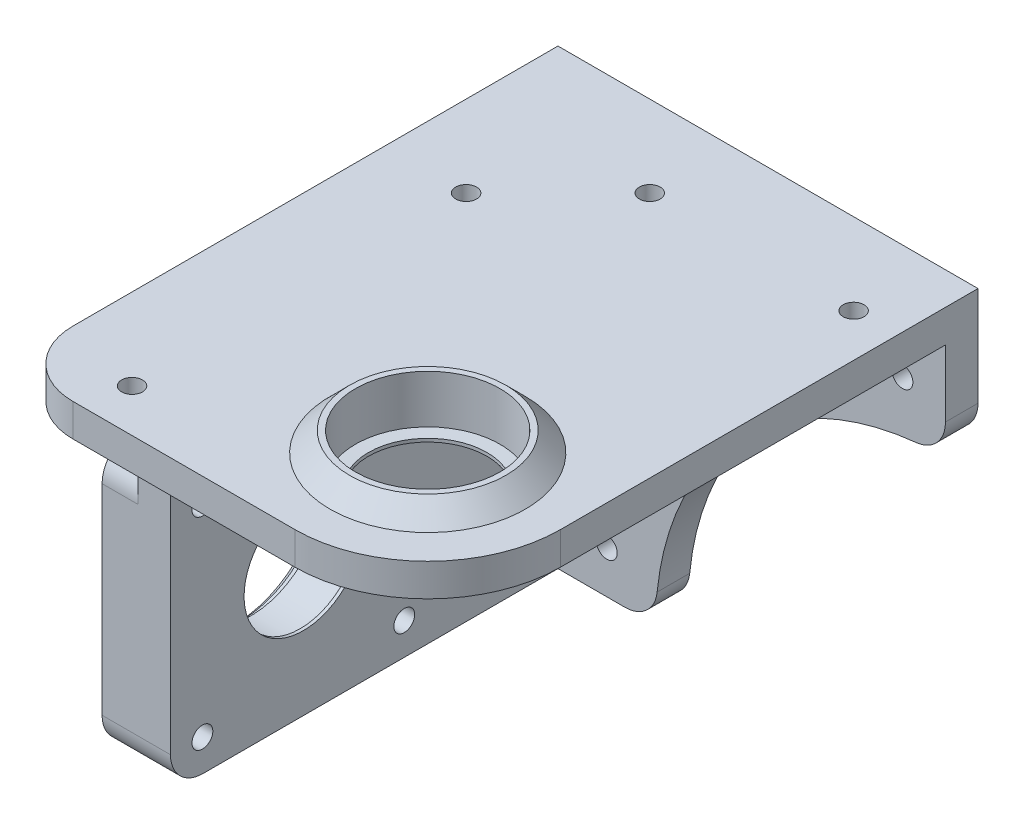
from build123d import *

# Parameters (mm, degrees)
SKETCH1_R           = 1.6
BOSS_EXTRUDE1_DEPTH = 5
BOSS_EXTRUDE2_DEPTH = 79.5
SKETCH3_R           = 11.1
CUT_EXTRUDE1_DEPTH  = 112.08808442
BOSS_EXTRUDE3_START = 3
SKETCH4_R           = 15
SKETCH4_R_2         = 11.1
BOSS_EXTRUDE3_DEPTH = 3
CHAMFER1_SIZE       = 3
BOSS_EXTRUDE4_START = -1
SKETCH5_R           = 11.1
SKETCH5_R_2         = 9.1
BOSS_EXTRUDE4_DEPTH = 1
CHAMFER2_SIZE       = 10
CHAMFER2_SIZE_2     = 0.5
SKETCH6_R           = 1.6
CUT_EXTRUDE2_DEPTH  = 112.08808442
SKETCH7_R           = 11.1
SKETCH7_R_2         = 1.6
CUT_EXTRUDE3_DEPTH  = 112.995814654
BOSS_EXTRUDE5_START = -1
SKETCH8_R           = 11.1
SKETCH8_R_2         = 9.1
BOSS_EXTRUDE5_DEPTH = 1
CHAMFER3_SIZE       = 10
CHAMFER3_SIZE_2     = 0.5
BOSS_EXTRUDE6_START = 5.5
SKETCH9_R           = 1.6
SKETCH9_R_2         = 11.1
BOSS_EXTRUDE6_DEPTH = 5.5
SKETCH10_R          = 12.5
CUT_EXTRUDE4_DEPTH  = 2.5
CHAMFER6_SIZE       = 1
CHAMFER5_SIZE       = 5.5
FILLET4_R           = 5
FILLET5_R           = 5
FILLET6_R           = 5
FILLET7_R           = 5
FILLET1_R           = 10


# Some blends are built 0.0001 mm under size
with BuildPart() as part:
    # Sketch1 → Boss-Extrude1 (new body)
    with BuildSketch(Plane.XY):
        with BuildLine():
            Line((-32.25, -32.25), (-16.996827309, -32.25))
            ThreePointArc((-16.996827309, -32.25), (-13.644608083, -30.959801378), (-12.022400308, -27.755050505))
            ThreePointArc((-12.022400308, -27.755050505), (0.783748237, -0.783748237), (27.755050505, 12.022400308))
            ThreePointArc((27.755050505, 12.022400308), (30.959801378, 13.644608083), (32.25, 16.996827309))
            Line((32.25, 16.996827309), (32.25, 32.25))
            Line((32.25, 32.25), (-32.25, 32.25))
            Line((-32.25, 32.25), (-32.25, -32.25))
        make_face()
        with Locations((-19.75, 19.75)):
            Circle(SKETCH1_R, mode=Mode.SUBTRACT)
        with Locations((-5.65, 19.75)):
            Circle(SKETCH1_R, mode=Mode.SUBTRACT)
        with Locations((25.65, 19.75)):
            Circle(SKETCH1_R, mode=Mode.SUBTRACT)
        with Locations((-19.75, 5.65)):
            Circle(SKETCH1_R, mode=Mode.SUBTRACT)
        with Locations((-19.75, -25.65)):
            Circle(SKETCH1_R, mode=Mode.SUBTRACT)
    extrude(amount=BOSS_EXTRUDE1_DEPTH)

    # Sketch2 → Boss-Extrude2 (add)
    with BuildSketch(Plane.XY.offset(5)):
        Polygon((-32.25, 32.25), (32.25, 32.25), (32.25, 27.25), (-27.25, 27.25), (-27.25, -32.25), (-32.25, -32.25), (-32.25, 27.25), align=None)
    extrude(amount=BOSS_EXTRUDE2_DEPTH)

    # Sketch3 → Cut-Extrude1 (cut, through all)
    with BuildSketch(Plane(origin=(0, 32.25, 0), x_dir=(1, 0, 0), z_dir=(0, 1, 0))):
        with Locations(Location((11.85, -64.1, 0), (0, 0, 270))):
            Circle(SKETCH3_R)
        with BuildLine():
            Line((11.85, -84.5), (11.85, -91.476631288))
            Line((11.85, -91.476631288), (44.100409765, -91.476631288))
            Line((44.100409765, -91.476631288), (44.100409765, -64.1))
            Line((44.100409765, -64.1), (32.25, -64.1))
            ThreePointArc((32.25, -64.1), (26.274978336, -78.524978336), (11.85, -84.5))
        make_face()
    extrude(amount=-CUT_EXTRUDE1_DEPTH, mode=Mode.SUBTRACT)

    # Sketch4 → Boss-Extrude3 (add)
    with BuildSketch(Plane(origin=(0, 32.25, 0), x_dir=(1, 0, 0), z_dir=(0, 1, 0)).offset(BOSS_EXTRUDE3_START)):
        with Locations(Location((11.85, -64.1, 0), (0, 0, 90))):
            Circle(SKETCH4_R)
        with Locations(Location((11.85, -64.1, 0), (0, 0, 270))):
            Circle(SKETCH4_R_2, mode=Mode.SUBTRACT)
    extrude(amount=-BOSS_EXTRUDE3_DEPTH)

    # Chamfer1
    chamfer1_edges = [part.edges().sort_by_distance(p)[0] for p in [
        (11.85, 35.25, 79.1),
    ]]
    chamfer(chamfer1_edges, length=CHAMFER1_SIZE - 0.0001)  # a hair under: the kernel refuses the full size

    # Sketch5 → Boss-Extrude4 (add)
    with BuildSketch(Plane.XZ.offset(-27.25).offset(BOSS_EXTRUDE4_START)):
        with Locations(Location((11.85, 64.1, 0), (0, 0, 90))):
            Circle(SKETCH5_R)
        with Locations(Location((11.85, 64.1, 0), (0, 0, 270))):
            Circle(SKETCH5_R_2, mode=Mode.SUBTRACT)
    extrude(amount=BOSS_EXTRUDE4_DEPTH)

    # Chamfer2
    # the kernel refuses this chamfer: 10, 0.5 mm, written as the material it takes off along each edge
    with BuildSketch(Plane(origin=(11.85, 28.25, 64.1), x_dir=(0, 0, -1), z_dir=(-1, 0, 0))) as chamfer2_piece_1_section:
        Polygon((9.1 + CHAMFER2_SIZE, 0), (9.1, CHAMFER2_SIZE_2), (9.1, 0), align=None)
    chamfer2_piece_1 = revolve(axis=Axis((11.85, 28.25, 64.1), (0, -1, 0)), mode=Mode.PRIVATE)
    chamfer2_piece_1 = chamfer2_piece_1 & Plane(origin=(11.85, 27.834786479, 64.1), x_dir=(0, 0, 1), z_dir=(0, 1, 0)) * Cylinder(11.1, 77, mode=Mode.PRIVATE)
    add(chamfer2_piece_1, mode=Mode.SUBTRACT)

    # Sketch6 → Cut-Extrude2 (cut, through all)
    with BuildSketch(Plane(origin=(0, 32.25, 0), x_dir=(1, 0, 0), z_dir=(0, 1, 0))):
        with Locations(Location((-19.75, -26.6, 0), (0, 0, 270))):
            Circle(SKETCH6_R)
        with Locations(Location((-19.75, -77.9, 0), (0, 0, 270))):
            Circle(SKETCH6_R)
        with Locations(Location((-5.65, -12.5, 0), (0, 0, 270))):
            Circle(SKETCH6_R)
        with Locations(Location((25.65, -12.5, 0), (0, 0, 270))):
            Circle(SKETCH6_R)
    extrude(amount=-CUT_EXTRUDE2_DEPTH, mode=Mode.SUBTRACT)

    # Sketch7 → Cut-Extrude3 (cut, through all)
    with BuildSketch(Plane.ZY.offset(32.25)):
        with Locations((44.1, -11.85)):
            Circle(SKETCH7_R)
        with Locations((28.6, -27.35)):
            Circle(SKETCH7_R_2)
        with Locations((57.9, 19.75)):
            Circle(SKETCH7_R_2)
        with Locations((26.6, 19.75)):
            Circle(SKETCH7_R_2)
        with Locations((12.5, 5.65)):
            Circle(SKETCH7_R_2)
        with Locations((12.5, -25.65)):
            Circle(SKETCH7_R_2)
        with Locations((28.6, 3.65)):
            Circle(SKETCH7_R_2)
        with Locations((59.6, 3.65)):
            Circle(SKETCH7_R_2)
        with Locations((59.6, -27.35)):
            Circle(SKETCH7_R_2)
        with BuildLine():
            Line((64.5, -32.25), (64.5, 19.75))
            ThreePointArc((64.5, 19.75), (66.696699141, 25.053300859), (72, 27.25))
            Line((72, 27.25), (84.5, 27.25))
            Line((84.5, 27.25), (84.5, -32.25))
            Line((84.5, -32.25), (64.5, -32.25))
        make_face()
    extrude(amount=-CUT_EXTRUDE3_DEPTH, mode=Mode.SUBTRACT)

    # Sketch8 → Boss-Extrude5 (add)
    with BuildSketch(Plane(origin=(-27.25, 0, 0), x_dir=(0, 0, -1), z_dir=(1, 0, 0)).offset(BOSS_EXTRUDE5_START)):
        with Locations(Location((-44.1, -11.85, 0), (0, 0, 180))):
            Circle(SKETCH8_R)
        with Locations(Location((-44.1, -11.85, 0), (0, 0, 90))):
            Circle(SKETCH8_R_2, mode=Mode.SUBTRACT)
    extrude(amount=BOSS_EXTRUDE5_DEPTH)

    # Chamfer3
    # the kernel refuses this chamfer: 10, 0.5 mm, written as the material it takes off along each edge
    with BuildSketch(Plane(origin=(-28.25, -11.85, 44.1), x_dir=(0, 1, 0), z_dir=(0, 0, -1))) as chamfer3_piece_1_section:
        Polygon((9.1 + CHAMFER3_SIZE, 0), (9.1, CHAMFER3_SIZE_2), (9.1, 0), align=None)
    chamfer3_piece_1 = revolve(axis=Axis((-28.25, -11.85, 44.1), (1, 0, 0)), mode=Mode.PRIVATE)
    chamfer3_piece_1 = chamfer3_piece_1 & Plane(origin=(-27.834786479, -11.85, 44.1), x_dir=(0, 0, 1), z_dir=(-1, 0, 0)) * Cylinder(11.1, 77, mode=Mode.PRIVATE)
    add(chamfer3_piece_1, mode=Mode.SUBTRACT)

    # Sketch9 → Boss-Extrude6 (add)
    with BuildSketch(Plane.ZY.offset(32.25).offset(BOSS_EXTRUDE6_START)):
        Polygon((64.5, -32.25), (23.7, -32.25), (18.2, -32.25), (18.2, 8.55), (23.7, 8.55), (64.5, 8.55), align=None)
        with Locations((28.6, -27.35)):
            Circle(SKETCH9_R, mode=Mode.SUBTRACT)
        with Locations((28.6, 3.65)):
            Circle(SKETCH9_R, mode=Mode.SUBTRACT)
        with Locations((44.1, -11.85)):
            Circle(SKETCH9_R_2, mode=Mode.SUBTRACT)
        with Locations((59.6, 3.65)):
            Circle(SKETCH9_R, mode=Mode.SUBTRACT)
        with Locations((59.6, -27.35)):
            Circle(SKETCH9_R, mode=Mode.SUBTRACT)
    extrude(amount=-BOSS_EXTRUDE6_DEPTH)

    # Sketch10 → Cut-Extrude4 (cut)
    with BuildSketch(Plane.ZY.offset(37.75)):
        with Locations((44.1, -11.85)):
            Circle(SKETCH10_R)
    extrude(amount=-CUT_EXTRUDE4_DEPTH, mode=Mode.SUBTRACT)

    # Chamfer6
    chamfer6_edges = [part.edges().sort_by_distance(p)[0] for p in [
        (-37.75, -11.85, 31.6),
    ]]
    chamfer(chamfer6_edges, length=CHAMFER6_SIZE)

    # Chamfer5
    chamfer5_edges = [part.edges().sort_by_distance(p)[0] for p in [
        (-37.75, -11.85, 18.2),
    ]]
    chamfer(chamfer5_edges, length=CHAMFER5_SIZE - 0.0001)  # a hair under: the kernel refuses the full size

    # Fillet4
    fillet4_edges = [part.edges().sort_by_distance(p)[0] for p in [
        (-32.5, -32.25, 64.5),
    ]]
    fillet(fillet4_edges, radius=FILLET4_R)

    # Fillet5
    fillet5_edges = [part.edges().sort_by_distance(p)[0] for p in [
        (-35, 8.55, 64.5),
    ]]
    fillet(fillet5_edges, radius=FILLET5_R)

    # Fillet6
    fillet6_edges = [part.edges().sort_by_distance(p)[0] for p in [
        (-35.00005, 8.55, 20.94995),
    ]]
    fillet(fillet6_edges, radius=FILLET6_R)

    # Fillet7
    # the kernel refuses this fillet: 5 mm, written as the material it takes off along each edge
    with BuildSketch(Plane(origin=(-46.588834765, -32.25, 32.538734765), x_dir=(0, 1, 0), z_dir=(0.7071067811865478, 0, -0.7071067811865474))) as fillet7_piece_1_section:
        with BuildLine():
            CenterArc((FILLET7_R, FILLET7_R), FILLET7_R, 180, 90)
            Line((0, FILLET7_R), (0, 0))
            Line((0, 0), (FILLET7_R, 0))
        make_face()
    fillet7_piece_1 = extrude(amount=32.778033172, mode=Mode.PRIVATE)
    fillet7_piece_1 = split(fillet7_piece_1, bisect_by=Plane(origin=(-32.25, -31.133160306, 22.529349846), z_dir=(-1, 0, 0)), keep=Keep.TOP, mode=Mode.PRIVATE)
    add(fillet7_piece_1, mode=Mode.SUBTRACT)

    # Fillet1
    fillet1_edges = [part.edges().sort_by_distance(p)[0] for p in [
        (-32.25, 29.75, 84.5),
    ]]
    fillet(fillet1_edges, radius=FILLET1_R)


solid = part.part
